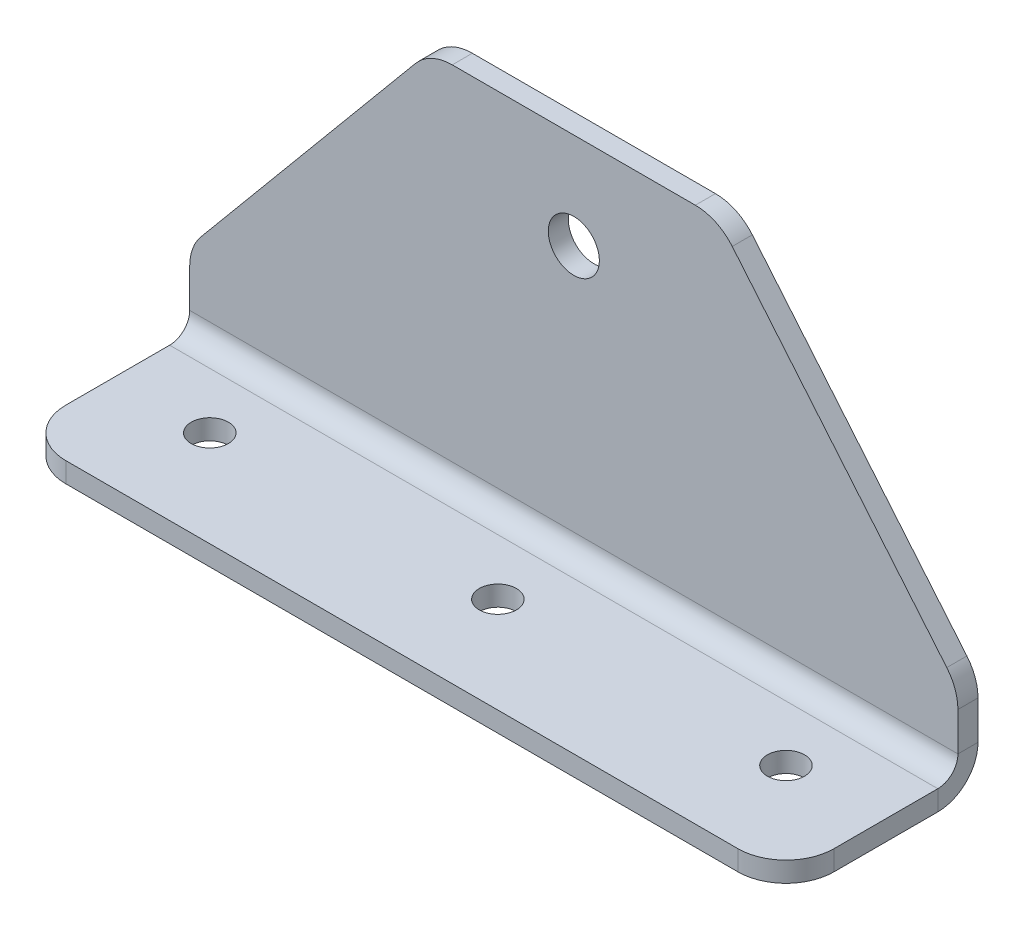
from build123d import *

# Parameters (mm, degrees)
BASE_FLANGE1_DEPTH           = 2.65684
EDGE_FLANGE1_STRIP_W         = 15.94104
EDGE_FLANGE1_STRIP_H         = 2.65684
EDGE_FLANGE1_STRIP_CUT_DEPTH = 101.6
EDGE_FLANGE1_DEPTH           = 101.6
FILLET1_R                    = 6.35
F_10_0_1935_DIAMETER_HOLE1_D = 4.9149
F_1_4_CLEARANCE_HOLE1_D      = 6.7564


# Sheet-metal steps are written as plain solids
with BuildPart() as part:
    # Sketch1 → Base-Flange1 (new body)
    with BuildSketch(Plane.XY):
        Polygon((0, 0), (0, 12.7), (31.75, 50.8), (69.85, 50.8), (101.6, 12.7), (101.6, 0), align=None)
    extrude(amount=-BASE_FLANGE1_DEPTH)

    # Edge-Flange1 strip (across the edge) → Edge-Flange1 strip cut (cut)
    with BuildSketch(Plane.YZ):
        with Locations((-2.65684, -1.32842)):
            Rectangle(EDGE_FLANGE1_STRIP_W, EDGE_FLANGE1_STRIP_H)
    extrude(amount=EDGE_FLANGE1_STRIP_CUT_DEPTH, mode=Mode.SUBTRACT)

    # Edge-Flange1 section (across the edge) → Edge-Flange1 (add)
    with BuildSketch(Plane.YZ):
        with BuildLine():
            Line((0, 2.65684), (0, 22.74316))
            Line((0, 22.74316), (2.65684, 22.74316))
            Line((2.65684, 22.74316), (2.65684, 2.65684))
            ThreePointArc((2.65684, 2.65684), (3.435010419, 0.778170419), (5.31368, 0))
            Line((5.31368, 0), (5.31368, -2.65684))
            ThreePointArc((5.31368, -2.65684), (1.556340839, -1.100499161), (0, 2.65684))
        make_face()
    extrude(amount=EDGE_FLANGE1_DEPTH)

    # Fillet1
    fillet1_edges = [part.edges().sort_by_distance(p)[0] for p in [
        (0, 12.7, -1.32842),
        (31.75, 50.8, -1.32842),
        (69.85, 50.8, -1.32842),
        (101.6, 12.7, -1.32842),
        (0, 1.32842, 22.74316),
        (101.6, 1.32842, 22.74316),
    ]]
    fillet(fillet1_edges, radius=FILLET1_R)

    # #10 (0.1935) Diameter Hole1 (through all)
    with Locations(Plane(origin=(0, 0, 0), x_dir=(-1, 0, 0), z_dir=(0, -1, 0))):
        with Locations((-88.9, -10.04316), (-50.8, -10.04316), (-12.7, -10.04316)):
            Hole(F_10_0_1935_DIAMETER_HOLE1_D / 2)

    # 1/4 Clearance Hole1 (through all)
    with Locations(Plane.XY):
        with Locations((50.8, 38.1)):
            Hole(F_1_4_CLEARANCE_HOLE1_D / 2)


solid = part.part
